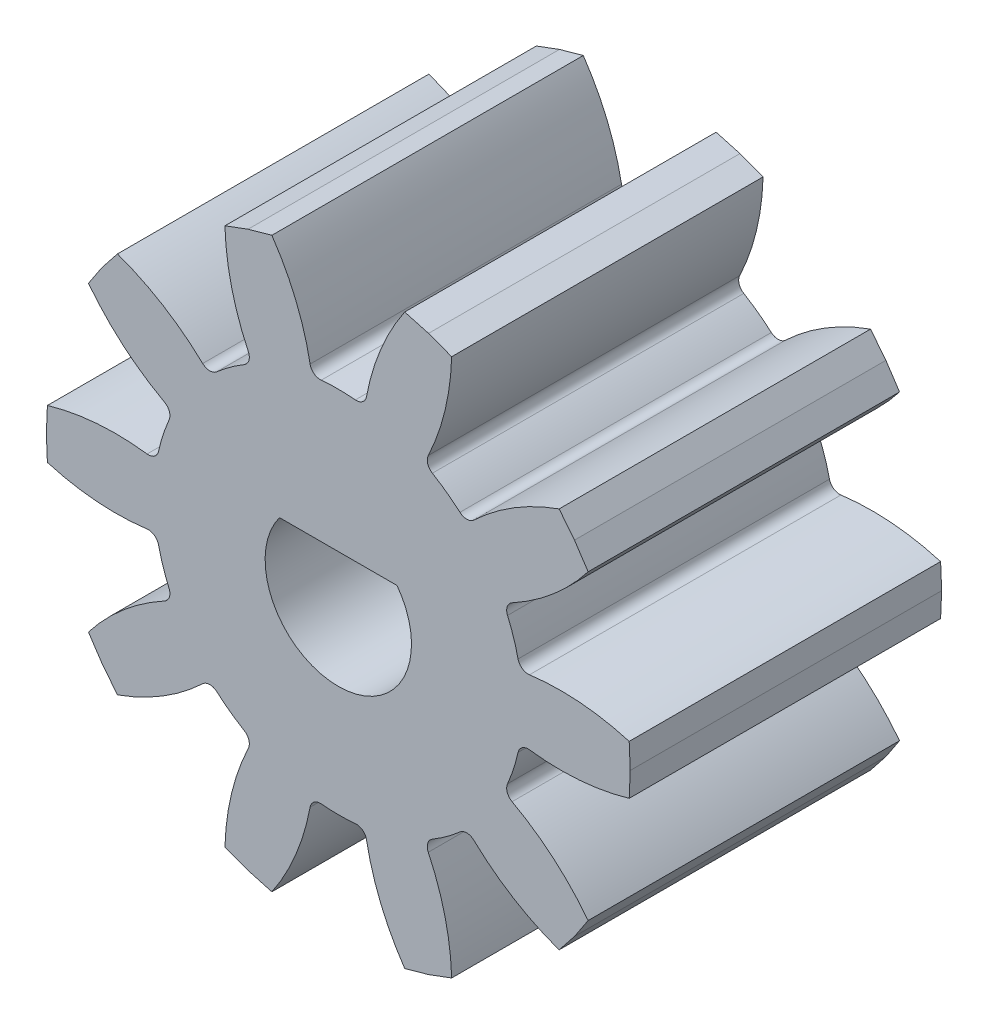
from build123d import *

# Parameters (mm, degrees)
BOSS_EXTRUDE1_DEPTH      = 10
FILLET1_R                = 0.3325
CIRPATTERN1_COUNT        = 10
FILLET1_OF_CIRPATTERN1_R = 0.3325
CUT_EXTRUDE1_REACH       = 18.469


with BuildPart() as part:
    # Sketch1 → Boss-Extrude1 (new body)
    with BuildSketch(Plane.XY):
        with BuildLine():
            Line((9.341432411, 0.79263202), (9.375, 0))
            Line((9.375, 0), (9.341432411, -0.79263202))
            ThreePointArc((9.341432411, -0.79263202), (7.598841712, -1.095238192), (5.832900278, -0.997035904))
            ThreePointArc((5.832900278, -0.997035904), (5.745453128, -1.416536128), (5.627876935, -1.828608064))
            Line((5.627876935, -1.828608064), (0, 0))
            Line((0, 0), (5.627876935, 1.828608064))
            ThreePointArc((5.627876935, 1.828608064), (5.745453128, 1.416536128), (5.832900278, 0.997035904))
            ThreePointArc((5.832900278, 0.997035904), (7.598841712, 1.095238192), (9.341432411, 0.79263202))
        make_face()
    boss_extrude1 = extrude(amount=BOSS_EXTRUDE1_DEPTH)

    # Fillet1
    fillet1_edges = [part.edges().sort_by_distance(p)[0] for p in [
        (5.832900278, 0.997035904, 5),
        (5.832900278, -0.997035904, 5),
    ]]
    fillet(fillet1_edges, radius=FILLET1_R)

    # CirPattern1: Boss-Extrude1 ×10 about axis
    cirpattern1_axis = Axis((0, 0, 10), (0, 0, -1))
    for i in range(1, CIRPATTERN1_COUNT):
        add(boss_extrude1.rotate(cirpattern1_axis, i * 360 / CIRPATTERN1_COUNT))

    # Fillet1 of CirPattern1
    fillet1_of_cirpattern1_edges = [part.edges().sort_by_distance(p)[0] for p in [
        (5.304958452, -2.621873772, 5),
        (4.132872452, -4.235111752, 5),
        (2.750702806, -5.23931678, 5),
        (0.854227819, -5.855518857, 5),
        (-0.854227819, -5.855518857, 5),
        (-2.750702806, -5.23931678, 5),
        (-4.132872452, -4.235111752, 5),
        (-5.304958452, -2.621873772, 5),
        (-5.832900278, -0.997035904, 5),
        (-5.832900278, 0.997035904, 5),
        (-5.304958452, 2.621873772, 5),
        (-4.132872452, 4.235111752, 5),
        (-2.750702806, 5.23931678, 5),
        (-0.854227819, 5.855518857, 5),
        (0.854227819, 5.855518857, 5),
        (2.750702806, 5.23931678, 5),
        (4.132872452, 4.235111752, 5),
        (5.304958452, 2.621873772, 5),
    ]]
    fillet(fillet1_of_cirpattern1_edges, radius=FILLET1_OF_CIRPATTERN1_R)

    # Sketch2 → Cut-Extrude1 (cut, up to next)
    with BuildSketch(Plane(origin=(0, 0, 0), x_dir=(-1, 0, 0), z_dir=(0, 0, -1)), mode=Mode.PRIVATE) as cut_extrude1_sk1:
        with BuildLine():
            Line((-1.887458609, 1.4), (1.887458609, 1.4))
            ThreePointArc((1.887458609, 1.4), (0, -2.35), (-1.887458609, 1.4))
        make_face()
    cut_extrude1_tool1 = extrude(cut_extrude1_sk1.sketch, amount=-CUT_EXTRUDE1_REACH, mode=Mode.PRIVATE) & part.part
    add(cut_extrude1_tool1.solids().sort_by_distance((0, -0.302037, 0))[0], mode=Mode.SUBTRACT)


solid = part.part
